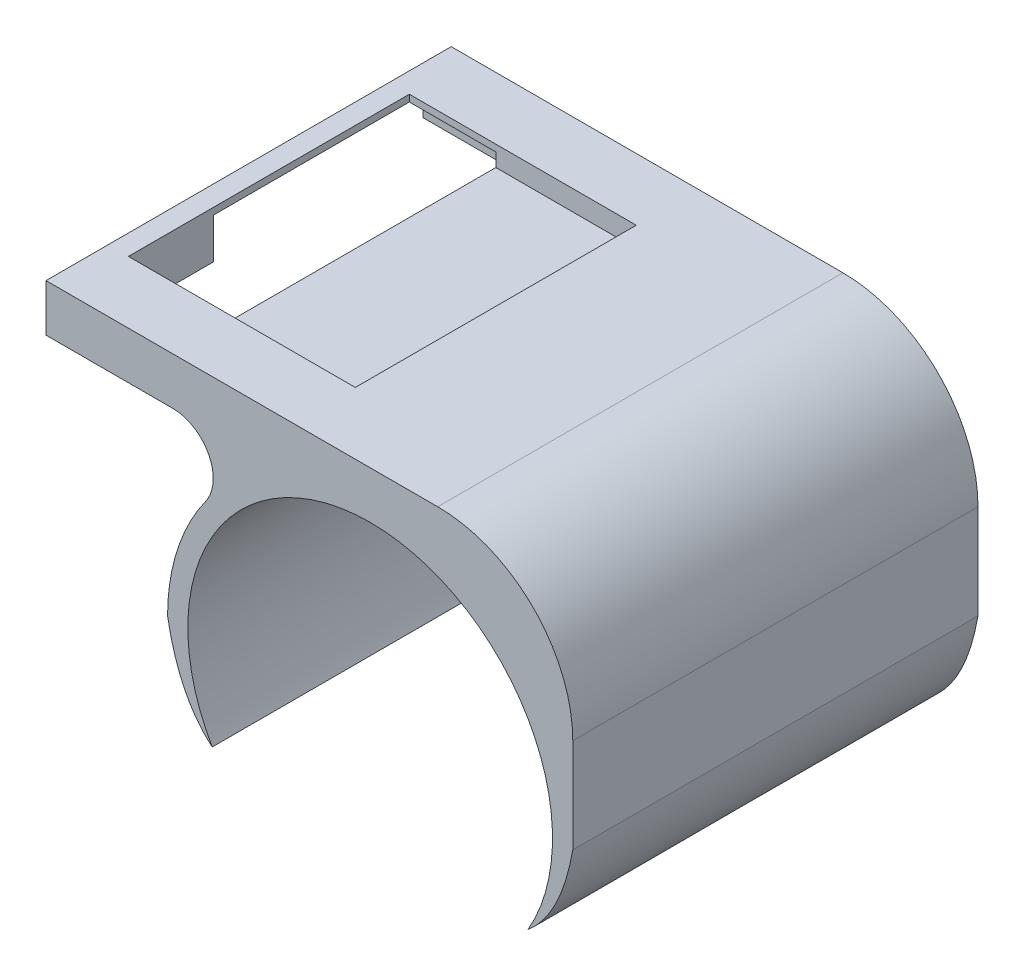
from build123d import *
from build123d.topology import SkipClean

# Parameters (mm, degrees)
SKETCH_2_W           = 5
SKETCH_2_H           = 5
EXTRUDE_3_DEPTH      = 30
CUT_EXTRUDE_10_DEPTH = 3
SKETCH_10_W          = 25.587445544
SKETCH_10_H          = 30
CUT_EXTRUDE_11_DEPTH = 1.5
SKETCH_11_W          = 16.6
SKETCH_11_H          = 21.6
SKETCH_11_W_2        = 16
SKETCH_11_H_2        = 21
CUT_EXTRUDE_13_DEPTH = 1.5
SKETCH_12_W          = 3.2
SKETCH_12_H          = 21.6
CUT_EXTRUDE_14_DEPTH = 2
FILLET_7_R           = 7
FILLET_8_R           = 3
SKETCH_13_W          = 4.016092165
SKETCH_13_H          = 18.031984282
CUT_EXTRUDE_15_DEPTH = 1.5
EXTRUDE_4_DEPTH      = 1.5
SKETCH_15_W          = 10
SKETCH_15_H          = 30
EXTRUDE_6_DEPTH      = 8
SKETCH_17_R          = 13.5
CUT_EXTRUDE_16_DEPTH = 40.862263024
SKETCH_19_W          = 16.6
SKETCH_19_H          = 0.2
EXTRUDE_7_DEPTH      = 3.5
SKETCH_20_W          = 30
SKETCH_20_H          = 17
EXTRUDE_8_DEPTH      = 5.211662
FILLET_18_R          = 10
SKETCH_21_R          = 13.5
CUT_EXTRUDE_17_DEPTH = 40.862263024
SKETCH_22_W          = 30
SKETCH_22_H          = 3.5
EXTRUDE_9_DEPTH      = 4
SKETCH_23_W          = 21.2
SKETCH_23_H          = 3.5
CUT_EXTRUDE_18_DEPTH = 4
EXTRUDE_START        = -3
SKETCH_24_R          = 1.1
EXTRUDE_10_DEPTH     = 3
SKETCH_25_W          = 21.2
SKETCH_25_H          = 1.5
EXTRUDE_11_DEPTH     = 4
SKETCH_27_W          = 16.6
SKETCH_27_H          = 3.5
EXTRUDE_12_DEPTH     = 0.5
SKETCH_28_W          = 16.6
SKETCH_28_H          = 3.5
EXTRUDE_13_DEPTH     = 0.5
SKETCH_29_W          = 20.2
SKETCH_29_H          = 2
EXTRUDE_14_DEPTH     = 1
CUT_EXTRUDE_19_DEPTH = 0.3
CUT_EXTRUDE_20_DEPTH = 0.3
SKETCH_32_W          = 20.8
SKETCH_32_H          = 3.5
CUT_EXTRUDE_21_DEPTH = 0.2
SKETCH_33_W          = 10.4
SKETCH_33_H          = 20.8
CUT_EXTRUDE_22_DEPTH = 1.5
SKETCH_34_W          = 0.328912479
SKETCH_34_H          = 2.5
SKETCH_34_W_2        = 6.071087521
CUT_EXTRUDE_24_DEPTH = 3


with BuildPart() as part:
    # 스케치2 → 보스-돌출3 (new body)
    with BuildSketch(Plane.XY):
        with Locations((-17.5, 16)):
            Rectangle(SKETCH_2_W, SKETCH_2_H)
        with BuildLine():
            Line((-6.659230275, 13.5), (-6.538348415, 13.5))
            ThreePointArc((-6.538348415, 13.5), (-3.354101966, 14.620191517), (0, 15))
            Line((0, 15), (0, 18.5))
            Line((0, 18.5), (-15, 18.5))
            Line((-15, 18.5), (-15, 13.5))
            Line((-15, 13.5), (-6.659230275, 13.5))
        make_face()
        with BuildLine():
            Line((0, 18.5), (0, 15))
            ThreePointArc((0, 15), (2.845384759, 14.72765377), (5.587445544, 13.920504743))
            Line((5.587445544, 13.920504743), (5.587445544, 18.5))
            Line((5.587445544, 18.5), (0, 18.5))
        make_face()
        with BuildLine():
            Line((0, 15), (0, 13.5))
            Line((0, 13.5), (5.587445544, 13.5))
            Line((5.587445544, 13.5), (5.587445544, 13.920504743))
            ThreePointArc((5.587445544, 13.920504743), (2.845384759, 14.72765377), (0, 15))
        make_face()
        with BuildLine():
            Line((-6.538348415, 13.5), (0, 13.5))
            Line((0, 13.5), (0, 15))
            ThreePointArc((0, 15), (-3.354101966, 14.620191517), (-6.538348415, 13.5))
        make_face()
        with BuildLine():
            ThreePointArc((-11.691342951, -6.75), (-11.691342951, 6.75), (0, 13.5))
            Line((0, 13.5), (-6.538348415, 13.5))
            ThreePointArc((-6.538348415, 13.5), (-12.709744809, 7.966328319), (-15, 0))
            add(Edge.make_bspline(
                [(-15, 0), (-14.169195888, -4.6958052), (-11.691342951, -6.75)],
                knots=[0, 0, 0, 0.391349689, 0.391349689, 0.391349689], degree=2))
        make_face()
        with BuildLine():
            Line((5.587445544, 13.920504743), (5.587445544, 13.5))
            Line((5.587445544, 13.5), (6.538348415, 13.5))
            ThreePointArc((6.538348415, 13.5), (6.066541506, 13.718493873), (5.587445544, 13.920504743))
        make_face()
        with BuildLine():
            Line((5.587445544, 13.5), (0, 13.5))
            ThreePointArc((0, 13.5), (9.545941546, 9.545941546), (13.5, 0))
            ThreePointArc((13.5, 0), (13.039998655, -3.494057109), (11.691342951, -6.75))
            add(Edge.make_bspline(
                [(15, 0), (14.169195888, -4.6958052), (11.691342951, -6.75)],
                knots=[0, 0, 0, 0.391349689, 0.391349689, 0.391349689], degree=2))
            ThreePointArc((15, 0), (12.709744809, 7.966328319), (6.538348415, 13.5))
            Line((6.538348415, 13.5), (5.587445544, 13.5))
        make_face()
    extrude(amount=EXTRUDE_3_DEPTH)

    # 스케치3 → 컷-돌출10 (cut)
    with BuildSketch(Plane(origin=(0, 18.5, 0), x_dir=(1, 0, 0), z_dir=(0, 1, 0))):
        with BuildLine():
            Line((-18, -4.5), (-18, -15))
            Line((-18, -15), (-18, -25.5))
            Line((-18, -25.5), (-5.67, -25.5))
            Line((-5.67, -25.5), (-5.67, -23.546313431))
            ThreePointArc((-5.67, -23.546313431), (-6.553883476, -21.412429955), (-4.42, -22.296313431))
            Line((-4.42, -22.296313431), (-2, -22.296313431))
            Line((-2, -22.296313431), (-2, -7.5))
            Line((-2, -7.5), (-4.42, -7.5))
            ThreePointArc((-4.42, -7.5), (-6.553883476, -8.383883476), (-5.67, -6.25))
            Line((-5.67, -6.25), (-5.67, -4.5))
            Line((-5.67, -4.5), (-18, -4.5))
        make_face()
        with BuildLine():
            Line((-2, -4.5), (-5.67, -4.5))
            Line((-5.67, -4.5), (-5.67, -6.25))
            ThreePointArc((-5.67, -6.25), (-4.786116524, -6.616116524), (-4.42, -7.5))
            Line((-4.42, -7.5), (-2, -7.5))
            Line((-2, -7.5), (-2, -4.5))
        make_face()
        with BuildLine():
            Line((-5.67, -23.546313431), (-5.67, -25.5))
            Line((-5.67, -25.5), (-2, -25.5))
            Line((-2, -25.5), (-2, -22.296313431))
            Line((-2, -22.296313431), (-4.42, -22.296313431))
            ThreePointArc((-4.42, -22.296313431), (-4.786116524, -23.180196907), (-5.67, -23.546313431))
        make_face()
    extrude(amount=-CUT_EXTRUDE_10_DEPTH, mode=Mode.SUBTRACT)

    # 스케치10 → 컷-돌출11 (cut)
    with BuildSketch(Plane(origin=(0, 18.5, 0), x_dir=(1, 0, 0), z_dir=(0, 1, 0))):
        with Locations((-7.206277228, -15)):
            Rectangle(SKETCH_10_W, SKETCH_10_H)
    extrude(amount=-CUT_EXTRUDE_11_DEPTH, mode=Mode.SUBTRACT)

    # 스케치11 → 컷-돌출13 (cut)
    with BuildSketch(Plane(origin=(0, 17, 0), x_dir=(1, 0, 0), z_dir=(0, 1, 0))):
        with Locations((-10, -15)):
            Rectangle(SKETCH_11_W, SKETCH_11_H)
        with Locations((-10, -15)):
            Rectangle(SKETCH_11_W_2, SKETCH_11_H_2, mode=Mode.SUBTRACT)
    extrude(amount=-CUT_EXTRUDE_13_DEPTH, mode=Mode.SUBTRACT)

    # 스케치12 → 컷-돌출14 (cut)
    with BuildSketch(Plane(origin=(0, 15.5, 0), x_dir=(1, 0, 0), z_dir=(0, 1, 0))):
        with Locations((-16.7, -15)):
            Rectangle(SKETCH_12_W, SKETCH_12_H)
    extrude(amount=-CUT_EXTRUDE_14_DEPTH, mode=Mode.SUBTRACT)

    # 필렛7
    # the kernel refuses this fillet: 7 mm, written as the material it takes off along each edge
    with BuildSketch(Plane(origin=(5.587445544, 17, -14.497767621), x_dir=(-1, 0, 0), z_dir=(0, 0, 1))) as fillet_7_piece_1:
        with BuildLine():
            CenterArc((5.799107049, 7), FILLET_7_R, 214.060784508, 55.939215492)
            Line((0, 3.079495257), (-0.115982141, 3.001085162))
            ThreePointArc((-0.115982141, 3.001085162), (-0.14, 1.539747629), (-0.14, 0))
            Line((-0.14, 0), (0, -0.14))
            Line((0, -0.14), (5.799107049, -0.14))
            Line((5.799107049, -0.14), (5.799107049, 0))
        make_face()
    extrude(amount=58.995535243, mode=Mode.SUBTRACT)

    # 필렛8
    fillet_8_edges = [part.edges().sort_by_distance(p)[0] for p in [
        (-6.538348415, 13.5, 15),
    ]]
    fillet(fillet_8_edges, radius=FILLET_8_R)

    # 스케치13 → 컷-돌출15 (cut)
    with BuildSketch(Plane(origin=(0, 17, 0), x_dir=(1, 0, 0), z_dir=(0, 1, 0))):
        with Locations((-5.720959824, -14.919139084)):
            Rectangle(SKETCH_13_W, SKETCH_13_H)
    extrude(amount=-CUT_EXTRUDE_15_DEPTH, mode=Mode.SUBTRACT)

    # 스케치14 → 보스-돌출4 (add)
    with BuildSketch(Plane(origin=(0, 15.5, 0), x_dir=(1, 0, 0), z_dir=(0, 1, 0))):
        with BuildLine():
            ThreePointArc((-3.1, -7.2), (-3.422182541, -6.422182541), (-4.2, -6.1))
            Line((-4.2, -6.1), (-4.2, -7.2))
            Line((-4.2, -7.2), (-3.1, -7.2))
        make_face()
        with BuildLine():
            Line((-4.2, -7.2), (-4.2, -6.1))
            ThreePointArc((-4.2, -6.1), (-4.977817459, -7.977817459), (-3.1, -7.2))
            Line((-3.1, -7.2), (-4.2, -7.2))
        make_face()
        with BuildLine():
            ThreePointArc((-3.1, -22.8), (-4.977817459, -22.022182541), (-4.2, -23.9))
            Line((-4.2, -23.9), (-4.2, -22.8))
            Line((-4.2, -22.8), (-3.1, -22.8))
        make_face()
        with BuildLine():
            Line((-4.2, -22.8), (-4.2, -23.9))
            ThreePointArc((-4.2, -23.9), (-3.422182541, -23.577817459), (-3.1, -22.8))
            Line((-3.1, -22.8), (-4.2, -22.8))
        make_face()
    extrude(amount=EXTRUDE_4_DEPTH)

    # 스케치15 → 보스-돌출6 (add)
    with BuildSketch(Plane(origin=(0, 17, 0), x_dir=(1, 0, 0), z_dir=(0, 1, 0))):
        with Locations((4.788338495, -15)):
            Rectangle(SKETCH_15_W, SKETCH_15_H)
    extrude(amount=-EXTRUDE_6_DEPTH)

    # 스케치17 → 컷-돌출16 (cut, through all)
    with BuildSketch(Plane(origin=(0, 0, 0), x_dir=(-1, 0, 0), z_dir=(0, 0, -1))):
        Circle(SKETCH_17_R)
    extrude(amount=-CUT_EXTRUDE_16_DEPTH, mode=Mode.SUBTRACT)

    # 스케치19 → 보스-돌출7 (add)
    with BuildSketch(Plane(origin=(0, 17, 0), x_dir=(1, 0, 0), z_dir=(0, 1, 0))):
        with Locations((-10, -4.3)):
            Rectangle(SKETCH_19_W, SKETCH_19_H)
        with Locations((-10, -25.7)):
            Rectangle(SKETCH_19_W, SKETCH_19_H)
    extrude(amount=-EXTRUDE_7_DEPTH)

    # 스케치20 → 보스-돌출8 (add)
    with BuildSketch(Plane(origin=(9.788338495, 0, 0), x_dir=(0, 0, -1), z_dir=(1, 0, 0))):
        with Locations((-15, 8.5)):
            Rectangle(SKETCH_20_W, SKETCH_20_H)
    extrude(amount=EXTRUDE_8_DEPTH)

    # 필렛18
    fillet_18_edges = [part.edges().sort_by_distance(p)[0] for p in [
        (15.000000495, 17, 15),
    ]]
    fillet(fillet_18_edges, radius=FILLET_18_R)

    # 스케치21 → 컷-돌출17 (cut, through all)
    with SkipClean():  # the faces are left unmerged after this step: merging them gives an invalid solid
        with BuildSketch(Plane.XY.offset(30)):
            Circle(SKETCH_21_R)
        extrude(amount=-CUT_EXTRUDE_17_DEPTH, mode=Mode.SUBTRACT)

    # 스케치22 → 보스-돌출9 (add)
    with SkipClean():  # the faces are left unmerged after this step: merging them gives an invalid solid
        with BuildSketch(Plane.ZY.offset(20)):
            with Locations((15, 15.25)):
                Rectangle(SKETCH_22_W, SKETCH_22_H)
        extrude(amount=EXTRUDE_9_DEPTH)

    # 스케치23 → 컷-돌출18 (cut)
    with SkipClean():  # the faces are left unmerged after this step: merging them gives an invalid solid
        with BuildSketch(Plane(origin=(-18.3, 0, 0), x_dir=(0, 0, -1), z_dir=(1, 0, 0))):
            with Locations((-15, 15.25)):
                Rectangle(SKETCH_23_W, SKETCH_23_H)
        extrude(amount=-CUT_EXTRUDE_18_DEPTH, mode=Mode.SUBTRACT)

    # 스케치24 → 보스-돌출10 (add)
    with SkipClean():  # the faces are left unmerged after this step: merging them gives an invalid solid
        with BuildSketch(Plane(origin=(0, 17, 0), x_dir=(1, 0, 0), z_dir=(0, 1, 0)).offset(EXTRUDE_START)):
            with Locations(Location((-4.2, -7.2, 0), (0, 0, 270))):
                Circle(SKETCH_24_R)
            with Locations(Location((-8.2, -7.2, 0), (0, 0, 270))):
                Circle(SKETCH_24_R)
            with Locations(Location((-8.2, -22.8, 0), (0, 0, 270))):
                Circle(SKETCH_24_R)
        extrude(amount=EXTRUDE_10_DEPTH)

    # 스케치25 → 보스-돌출11 (add)
    with SkipClean():  # the faces are left unmerged after this step: merging them gives an invalid solid
        with BuildSketch(Plane.ZY.offset(1.7)):
            with Locations((15, 16.25)):
                Rectangle(SKETCH_25_W, SKETCH_25_H)
        extrude(amount=EXTRUDE_11_DEPTH)

    # 스케치27 → 보스-돌출12 (add)
    with SkipClean():  # the faces are left unmerged after this step: merging them gives an invalid solid
        with BuildSketch(Plane.XY.offset(4.4)):
            with Locations((-14, 15.25)):
                Rectangle(SKETCH_27_W, SKETCH_27_H)
        extrude(amount=EXTRUDE_12_DEPTH)

    # 스케치28 → 보스-돌출13 (add)
    with SkipClean():  # the faces are left unmerged after this step: merging them gives an invalid solid
        with BuildSketch(Plane(origin=(0, 0, 25.6), x_dir=(-1, 0, 0), z_dir=(0, 0, -1))):
            with Locations((14, 15.25)):
                Rectangle(SKETCH_28_W, SKETCH_28_H)
        extrude(amount=EXTRUDE_13_DEPTH)

    # 스케치29 → 보스-돌출14 (add)
    with SkipClean():  # the faces are left unmerged after this step: merging them gives an invalid solid
        with BuildSketch(Plane.ZY.offset(15.1)):
            with Locations((15, 14.5)):
                Rectangle(SKETCH_29_W, SKETCH_29_H)
        extrude(amount=EXTRUDE_14_DEPTH)

    # 스케치30 → 컷-돌출19 (cut)
    with SkipClean():  # the faces are left unmerged after this step: merging them gives an invalid solid
        with BuildSketch(Plane(origin=(0, 0, 25.1), x_dir=(-1, 0, 0), z_dir=(0, 0, -1))):
            Polygon((5.7, 15.5), (16.1, 15.5), (16.1, 13.5), (22.3, 13.5), (22.3, 17), (5.7, 17), align=None)
        extrude(amount=-CUT_EXTRUDE_19_DEPTH, mode=Mode.SUBTRACT)

    # 스케치31 → 컷-돌출20 (cut)
    with SkipClean():  # the faces are left unmerged after this step: merging them gives an invalid solid
        with BuildSketch(Plane.XY.offset(4.9)):
            Polygon((-16.1, 13.5), (-16.1, 15.5), (-5.7, 15.5), (-5.7, 17), (-22.3, 17), (-22.3, 13.5), align=None)
        extrude(amount=-CUT_EXTRUDE_20_DEPTH, mode=Mode.SUBTRACT)

    # 스케치32 → 컷-돌출21 (cut)
    with SkipClean():  # the faces are left unmerged after this step: merging them gives an invalid solid
        with BuildSketch(Plane(origin=(-22.3, 0, 0), x_dir=(0, 0, -1), z_dir=(1, 0, 0))):
            with Locations((-15, 15.25)):
                Rectangle(SKETCH_32_W, SKETCH_32_H)
        extrude(amount=-CUT_EXTRUDE_21_DEPTH, mode=Mode.SUBTRACT)

    # 스케치33 → 컷-돌출22 (cut)
    with SkipClean():  # the faces are left unmerged after this step: merging them gives an invalid solid
        with BuildSketch(Plane(origin=(0, 17, 0), x_dir=(1, 0, 0), z_dir=(0, 1, 0))):
            with Locations((-10.9, -15)):
                Rectangle(SKETCH_33_W, SKETCH_33_H)
        extrude(amount=-CUT_EXTRUDE_22_DEPTH, mode=Mode.SUBTRACT)

    # 스케치34 → 컷-돌출24 (cut)
    with SkipClean():  # the faces are left unmerged after this step: merging them gives an invalid solid
        with BuildSketch(Plane.XZ.offset(-13.5)):
            with Locations((-16.264456239, 3.35)):
                Rectangle(SKETCH_34_W, SKETCH_34_H)
            with Locations((-19.46445624, 3.35)):
                Rectangle(SKETCH_34_W_2, SKETCH_34_H)
            Polygon((-22.5, 2.1), (-22.5, 4.6), (-22.5, 19.1), (-24, 19.1), (-24, 2.1), align=None)
        extrude(amount=-CUT_EXTRUDE_24_DEPTH, mode=Mode.SUBTRACT)


solid = part.part
